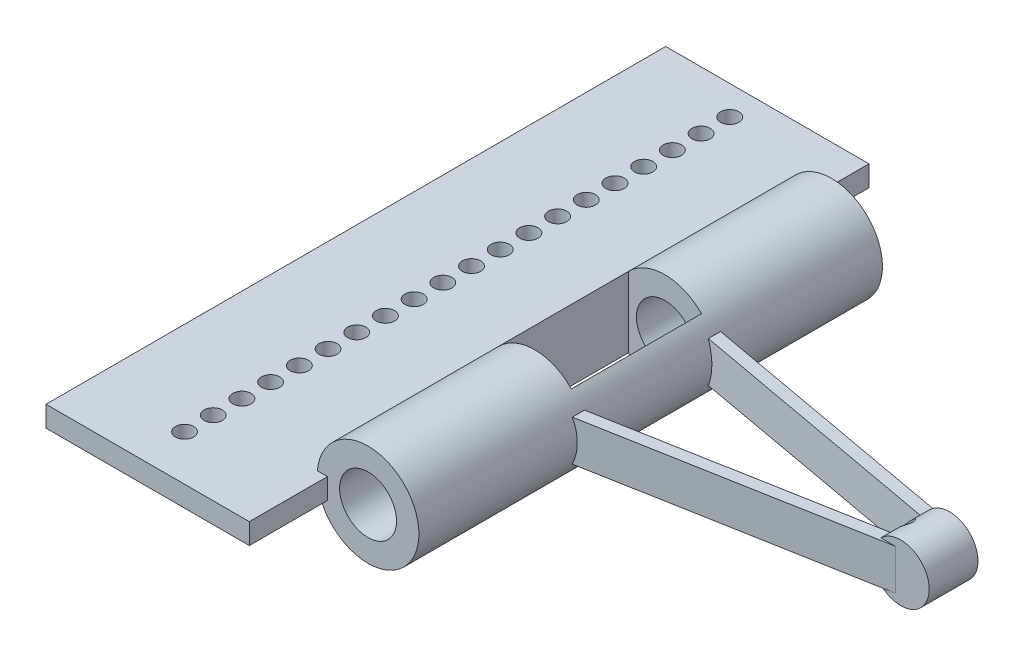
from build123d import *

# Parameters (mm, degrees)
SKETCH1_R           = 12.5
BOSS_EXTRUDE1_DEPTH = 57
SKETCH2_R           = 7
CUT_EXTRUDE1_DEPTH  = 60
SKETCH3_W           = 18
SKETCH3_H           = 32
CUT_EXTRUDE2_DEPTH  = 30
BOSS_EXTRUDE2_START = 2.9
SKETCH4_W           = 50
SKETCH4_H           = 152.4
SKETCH4_R           = 2.25
BOSS_EXTRUDE2_DEPTH = 5.1
BOSS_EXTRUDE3_START = 2
BOSS_EXTRUDE3_DEPTH = 10
SKETCH6_R           = 7
BOSS_EXTRUDE4_DEPTH = 6
SKETCH7_R           = 1.5
CUT_EXTRUDE3_DEPTH  = 14


with BuildPart() as part:
    # Sketch1 → Boss-Extrude1 (new, symmetric)
    with BuildSketch(Plane.XY):
        with Locations((0, 7)):
            Circle(SKETCH1_R)
    extrude(amount=BOSS_EXTRUDE1_DEPTH, both=True)

    # Sketch2 → Cut-Extrude1 (cut, symmetric)
    with BuildSketch(Plane.XY):
        with Locations((0, 7)):
            Circle(SKETCH2_R)
    extrude(amount=CUT_EXTRUDE1_DEPTH, both=True, mode=Mode.SUBTRACT)

    # Sketch3 → Cut-Extrude2 (cut, symmetric)
    with BuildSketch(Plane(origin=(0, 0, 0), x_dir=(1, 0, 0), z_dir=(0, 1, 0))):
        Rectangle(SKETCH3_W, SKETCH3_H)
    extrude(amount=CUT_EXTRUDE2_DEPTH, both=True, mode=Mode.SUBTRACT)

    # Sketch4 → Boss-Extrude2 (add)
    with BuildSketch(Plane(origin=(0, 0, 0), x_dir=(1, 0, 0), z_dir=(0, 1, 0)).offset(BOSS_EXTRUDE2_START)):
        with Locations((-35, 0)):
            Rectangle(SKETCH4_W, SKETCH4_H)
        with Locations((-37.1, 69.05)):
            Circle(SKETCH4_R, mode=Mode.SUBTRACT)
        with Locations((-37.1, 61.9935)):
            Circle(SKETCH4_R, mode=Mode.SUBTRACT)
        with Locations((-37.1, 54.937)):
            Circle(SKETCH4_R, mode=Mode.SUBTRACT)
        with Locations((-37.1, 47.8805)):
            Circle(SKETCH4_R, mode=Mode.SUBTRACT)
        with Locations((-37.1, 40.824)):
            Circle(SKETCH4_R, mode=Mode.SUBTRACT)
        with Locations((-37.1, 33.7675)):
            Circle(SKETCH4_R, mode=Mode.SUBTRACT)
        with Locations((-37.1, 26.711)):
            Circle(SKETCH4_R, mode=Mode.SUBTRACT)
        with Locations((-37.1, 19.6545)):
            Circle(SKETCH4_R, mode=Mode.SUBTRACT)
        with Locations((-37.1, 12.598)):
            Circle(SKETCH4_R, mode=Mode.SUBTRACT)
        with Locations((-37.1, 5.5415)):
            Circle(SKETCH4_R, mode=Mode.SUBTRACT)
        with Locations((-37.1, -1.515)):
            Circle(SKETCH4_R, mode=Mode.SUBTRACT)
        with Locations((-37.1, -8.5715)):
            Circle(SKETCH4_R, mode=Mode.SUBTRACT)
        with Locations((-37.1, -15.628)):
            Circle(SKETCH4_R, mode=Mode.SUBTRACT)
        with Locations((-37.1, -22.6845)):
            Circle(SKETCH4_R, mode=Mode.SUBTRACT)
        with Locations((-37.1, -29.741)):
            Circle(SKETCH4_R, mode=Mode.SUBTRACT)
        with Locations((-37.1, -36.7975)):
            Circle(SKETCH4_R, mode=Mode.SUBTRACT)
        with Locations((-37.1, -43.854)):
            Circle(SKETCH4_R, mode=Mode.SUBTRACT)
        with Locations((-37.1, -50.9105)):
            Circle(SKETCH4_R, mode=Mode.SUBTRACT)
        with Locations((-37.1, -57.967)):
            Circle(SKETCH4_R, mode=Mode.SUBTRACT)
        with Locations((-37.1, -65.0235)):
            Circle(SKETCH4_R, mode=Mode.SUBTRACT)
    extrude(amount=BOSS_EXTRUDE2_DEPTH)

    # Sketch5 → Boss-Extrude3 (add)
    with BuildSketch(Plane(origin=(0, 0, 0), x_dir=(1, 0, 0), z_dir=(0, 1, 0)).offset(BOSS_EXTRUDE3_START)):
        Polygon((9, 15.68), (9, 18.68), (80, 5.77), (80, 2.77), align=None)
        Polygon((9, -15.68), (9, -18.68), (80, -5.77), (80, -2.77), align=None)
    extrude(amount=BOSS_EXTRUDE3_DEPTH)

    # Sketch6 → Boss-Extrude4 (add, symmetric)
    with BuildSketch(Plane.XY):
        with Locations((80, 7)):
            Circle(SKETCH6_R)
    extrude(amount=BOSS_EXTRUDE4_DEPTH, both=True)

    # Sketch7 → Cut-Extrude3 (cut, symmetric)
    with BuildSketch(Plane(origin=(0, 0, 0), x_dir=(1, 0, 0), z_dir=(0, 1, 0))):
        with Locations((75.5, 0)):
            Circle(SKETCH7_R)
    extrude(amount=CUT_EXTRUDE3_DEPTH, both=True, mode=Mode.SUBTRACT)


solid = part.part
